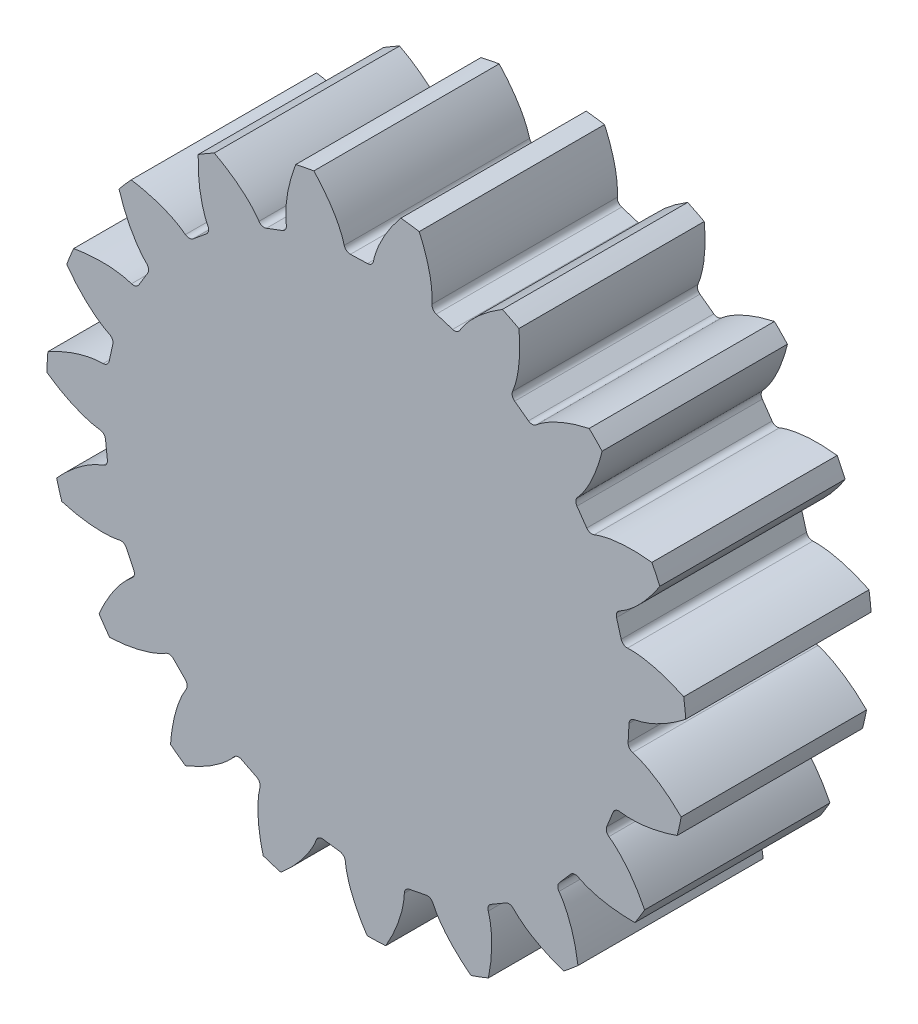
from build123d import *

# Parameters (mm, degrees)
SKETCH2_R                = 13.125
BOSS_EXTRUDE1_DEPTH      = 7.6
CUT_EXTRUDE1_DEPTH       = 7.6
FILLET1_R                = 0.254
CIRPATTERN3_COUNT        = 19
FILLET1_OF_CIRPATTERN3_R = 0.254


# Read off the part's stored shape, not the designer's step: Cut-Extrude1
with BuildPart() as part:
    # Sketch2 → Boss-Extrude1 (new body)
    with BuildSketch(Plane.XY):
        with Locations(Location((0, 0, 0), (0, 0, 180))):
            Circle(SKETCH2_R)
    extrude(amount=BOSS_EXTRUDE1_DEPTH)

    # Cut-Extrude1 outline → Cut-Extrude1 (cut)
    with BuildSketch(Plane.XY):
        with BuildLine():
            add(Edge.make_bspline(
                [(10.762404971, 0), (10.770363433, 0), (10.792678609, 0.000521318), (10.834816936, 0.003565061), (10.903354274, 0.011447847), (10.990243693, 0.025763078), (11.101833256, 0.049142921), (11.232171412, 0.082916466), (11.373987934, 0.126507034), (11.526490236, 0.180843474), (11.676857873, 0.241105788), (11.825025279, 0.306785413), (11.970855726, 0.377192189), (12.145228099, 0.468272189), (12.351031789, 0.585497973), (12.586313502, 0.733922298), (12.807426208, 0.888220959), (12.963449394, 1.006351961), (13.053102876, 1.077063931), (13.079013358, 1.097740673)],
                knots=[0, 0, 0, 0, 0, 0.005376748, 0.015083688, 0.02853182, 0.046610139, 0.064854849, 0.092110525, 0.119476175, 0.146842495, 0.174208853, 0.201574955, 0.228941013, 0.256307345, 0.307035032, 0.361767351, 0.41649966, 0.438911625, 0.438911625, 0.438911625, 0.438911625, 0.438911625], degree=4))
            Line((10.762404971, 0), (10.702683853, -1.132218666))
            add(Edge.make_bspline(
                [(12.890953553, -2.467578065), (12.867362069, -2.444290244), (12.785645067, -2.364538997), (12.642915193, -2.230649673), (12.439261868, -2.053945886), (12.220900171, -1.881593239), (12.028570798, -1.743367138), (11.864747758, -1.63444835), (11.727133414, -1.549090717), (11.586697776, -1.468188152), (11.443504208, -1.39244137), (11.297564411, -1.32236301), (11.161120619, -1.26409505), (11.035058736, -1.216797177), (10.926547978, -1.181807706), (10.841646693, -1.158431034), (10.774318951, -1.143381774), (10.732734657, -1.135921916), (10.710598153, -1.133055906), (10.702683853, -1.132218666)],
                knots=[0.470179291, 0.470179291, 0.470179291, 0.470179291, 0.470179291, 0.492591256, 0.547323565, 0.602055884, 0.652783571, 0.680149903, 0.707515961, 0.734882063, 0.762248421, 0.789614741, 0.816980391, 0.844236067, 0.862480777, 0.880559096, 0.894007228, 0.903714168, 0.909090916, 0.909090916, 0.909090916, 0.909090916, 0.909090916], degree=4))
            ThreePointArc((12.890953553, -2.467578065), (13.106779534, -0.691343071), (13.079013358, 1.097740673))
        make_face()
    cut_extrude1 = extrude(amount=CUT_EXTRUDE1_DEPTH, mode=Mode.SUBTRACT)

    # Fillet1
    fillet1_edges = [part.edges().sort_by_distance(p)[0] for p in [
        (10.702683853, -1.132218666, 3.8),
        (10.762404971, 0, 3.8),
    ]]
    fillet(fillet1_edges, radius=FILLET1_R)

    # CirPattern3: Cut-Extrude1 ×19 about axis
    cirpattern3_axis = Axis((0, 0, 18.908609159), (0, 0, -1))
    for i in range(1, CIRPATTERN3_COUNT):
        add(cut_extrude1.rotate(cirpattern3_axis, i * 360 / CIRPATTERN3_COUNT), mode=Mode.SUBTRACT)

    # Fillet1 of CirPattern3
    fillet1_of_cirpattern3_edges = [part.edges().sort_by_distance(p)[0] for p in [
        (9.755152121, -4.546027702, 3.8),
        (10.179268184, -3.494547181, 3.8),
        (7.750498289, -7.467204097, 3.8),
        (8.493049741, -6.610405952, 3.8),
        (4.905957707, -9.579193063, 3.8),
        (5.886477576, -9.009924667, 3.8),
        (1.529780483, -10.653127824, 3.8),
        (2.642014227, -10.433078241, 3.8),
        (-2.012172193, -10.572630885, 3.8),
        (-0.888752358, -10.725645902, 3.8),
        (-5.33607479, -9.346425338, 3.8),
        (-4.323208835, -9.855923403, 3.8),
        (-8.081730885, -7.107389581, 3.8),
        (-7.289178553, -7.918158674, 3.8),
        (-9.951606039, -4.098157881, 3.8),
        (-9.465252672, -5.122338589, 3.8),
        (-10.743070263, -0.644827185, 3.8),
        (-10.615619795, -1.771433637, 3.8),
        (-10.370356128, 2.878380543, 3.8),
        (-10.615619795, 1.771433637, 3.8),
        (-8.873852994, 6.089671076, 3.8),
        (-9.465252672, 5.122338589, 3.8),
        (-6.415730196, 8.641051257, 3.8),
        (-7.289178553, 7.918158674, 3.8),
        (-3.262363481, 10.256039454, 3.8),
        (-4.323208835, 9.855923403, 3.8),
        (0.244530938, 10.759626638, 3.8),
        (-0.888752358, 10.725645902, 3.8),
        (3.724926635, 10.097241323, 3.8),
        (2.642014227, 10.433078241, 3.8),
        (6.801668734, 8.340663235, 3.8),
        (5.886477576, 9.009924667, 3.8),
        (9.141344486, 5.680244868, 3.8),
        (8.493049741, 6.610405952, 3.8),
        (10.490413721, 2.40428383, 3.8),
        (10.179268184, 3.494547181, 3.8),
    ]]
    fillet(fillet1_of_cirpattern3_edges, radius=FILLET1_OF_CIRPATTERN3_R)


solid = part.part
